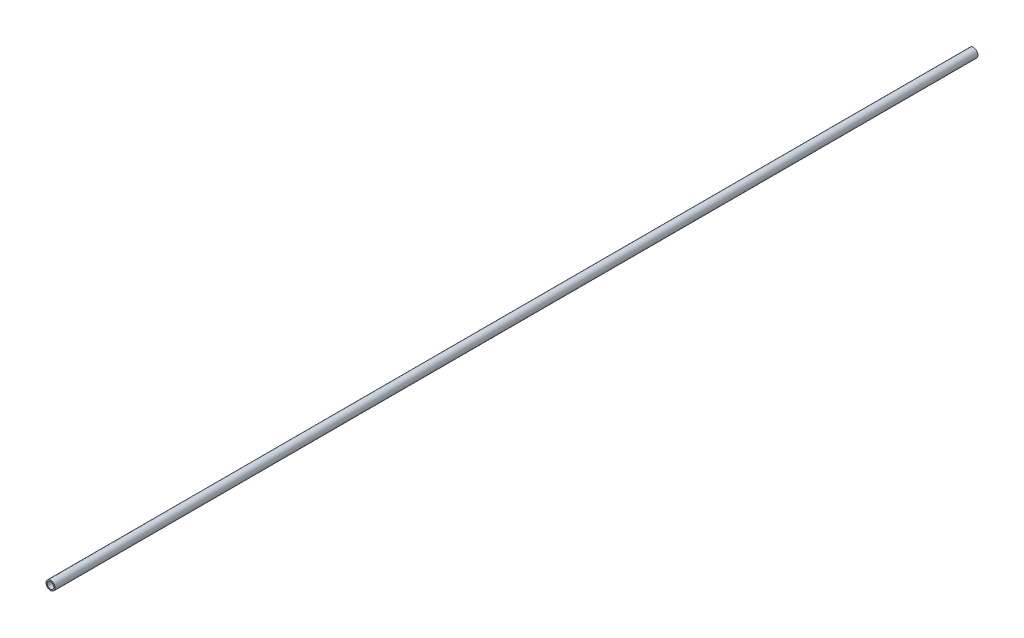
from build123d import *

# Parameters (mm, degrees)
SKETCH1_R           = 4.7625
SKETCH1_R_2         = 3.5179
BOSS_EXTRUDE1_DEPTH = 974.852


with BuildPart() as part:
    # Sketch1 → Boss-Extrude1 (new body)
    with BuildSketch(Plane.XY):
        Circle(SKETCH1_R)
        Circle(SKETCH1_R_2, mode=Mode.SUBTRACT)
    extrude(amount=BOSS_EXTRUDE1_DEPTH)


solid = part.part
